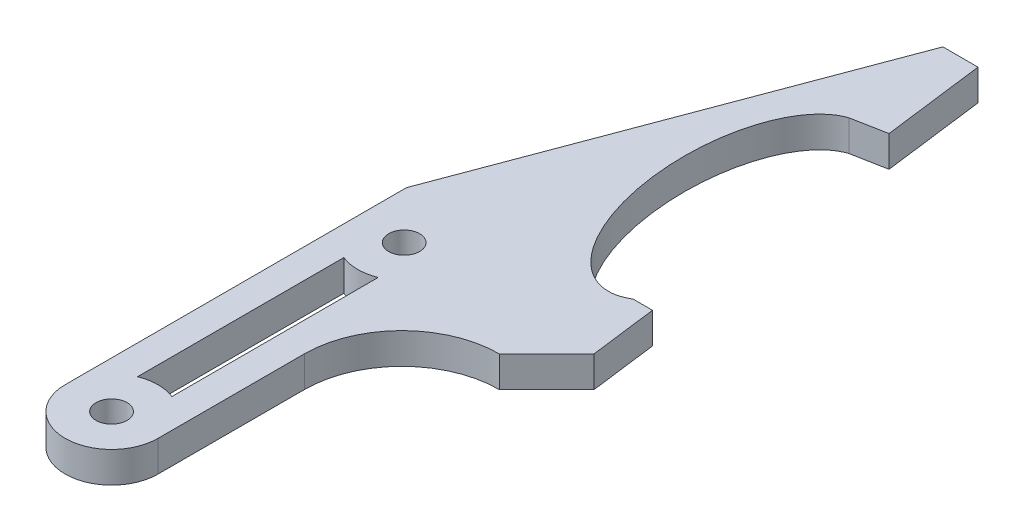
from build123d import *

# Parameters (mm, degrees)
CROQUIS1_R                   = 1.5875
SALIENTE_EXTRUIR1_DEPTH      = 3.175
CORTAR_EXTRUIR1_DEPTH        = 3.175
CORTAR_EXTRUIR3_DEPTH        = 10
CROQUIS4_R                   = 10
CORTAR_EXTRUIR4_DEPTH        = 10
REDONDEO1_R                  = 2
ENL_V_MAT_EXTRU_1_DEPTH      = 43.027736377
ENL_V_MAT_EXTRU_1_DEPTH_BACK = 4
ESQUISSE1_RX                 = 14
ESQUISSE1_RY                 = 7.031711939
ESQUISSE2_W                  = 9.071953096
ESQUISSE2_H                  = 3.948156649
ENL_V_MAT_EXTRU_2_DEPTH      = 43.02773651
CHANFREIN1_START             = -27.627623392
CHANFREIN1_OUTLINE_W         = 3.506874848
CHANFREIN1_OUTLINE_H         = 3.175
CHANFREIN1_DEPTH             = 1.390086692
CHANFREIN1_START_2           = -27.652783734
CHANFREIN1_2_OUTLINE_W       = 3.506874848
CHANFREIN1_2_OUTLINE_H       = 3.175
CHANFREIN1_2_DEPTH           = 0.025160342


with BuildPart() as part:
    # Croquis1 → Saliente-Extruir1 (new body)
    with BuildSketch(Plane(origin=(0, 0, 0), x_dir=(1, 0, 0), z_dir=(0, 1, 0))):
        with BuildLine():
            Line((-12.5, 0), (-12.5, -40))
            Line((-12.5, -40), (-2.975, -40))
            Line((-2.975, -40), (-2.975, -20))
            ThreePointArc((-2.975, -20), (-0.046067812, -12.928932188), (7.025, -10))
            Line((7.025, -10), (12.5, -10))
            Line((12.5, -10), (12.5, 40))
            Line((12.5, 40), (2.5, 40))
            Line((2.5, 40), (-12.5, 0))
        make_face()
        with Locations(Location((-7.7375, -5, 0), (0, 0, 270))):
            Circle(CROQUIS1_R, mode=Mode.SUBTRACT)
        with Locations(Location((-7.7375, -35, 0), (0, 0, 270))):
            Circle(CROQUIS1_R, mode=Mode.SUBTRACT)
    extrude(amount=SALIENTE_EXTRUIR1_DEPTH)

    # Croquis2 → Cortar-Extruir1 (cut)
    with BuildSketch(Plane(origin=(0, 3.175, 0), x_dir=(1, 0, 0), z_dir=(0, 1, 0))):
        Polygon((12.5, -10), (6.1, 40), (12.5, 40), align=None)
    extrude(amount=-CORTAR_EXTRUIR1_DEPTH, mode=Mode.SUBTRACT)

    # Croquis3 → Cortar-Extruir3 (cut)
    with BuildSketch(Plane(origin=(0, 3.175, 0), x_dir=(1, 0, 0), z_dir=(0, 1, 0))):
        with BuildLine():
            ThreePointArc((-5.975, -30.575635639), (-7.7375, -30.2375), (-9.5, -30.575635639))
            Line((-9.5, -30.575635639), (-9.5, -9.427055314))
            ThreePointArc((-9.5, -9.427055314), (-7.7375, -9.765), (-5.975, -9.427055314))
            Line((-5.975, -9.427055314), (-5.975, -14.803847577))
            Line((-5.975, -14.803847577), (-5.975, -30.575635639))
        make_face()
        with BuildLine():
            ThreePointArc((-12.5, -35), (-7.7375, -39.7625), (-2.975, -35))
            Line((-2.975, -35), (-2.975, -40))
            Line((-2.975, -40), (-12.5, -40))
            Line((-12.5, -40), (-12.5, -35))
        make_face()
    extrude(amount=-CORTAR_EXTRUIR3_DEPTH, mode=Mode.SUBTRACT)

    # Croquis4 → Cortar-Extruir4 (cut)
    with BuildSketch(Plane(origin=(0, 3.175, 0), x_dir=(1, 0, 0), z_dir=(0, 1, 0))):
        with Locations((9.274103387, 15.202317292)):
            Circle(CROQUIS4_R)
        Polygon((7.025, -10), (11.878723404, -5.146276596), (12.5, -10), align=None)
    extrude(amount=-CORTAR_EXTRUIR4_DEPTH, mode=Mode.SUBTRACT)

    # Redondeo1
    redondeo1_edges = [part.edges().sort_by_distance(p)[0] for p in [
        (8.004462032, 1.5875, -25.121390375),
        (10.543744741, 1.5875, -5.283244209),
    ]]
    fillet(redondeo1_edges, radius=REDONDEO1_R)

    # Esquisse1 → Enlèv. mat.-Extru.1 (cut, two sides: drawn at the far end of the back side and taken through both)
    with BuildSketch(Plane.XZ.offset(-ENL_V_MAT_EXTRU_1_DEPTH_BACK)):
        with Locations(Location((6.06176106, -15.09925225), (0, 0, -95.443545347))):
            Ellipse(ESQUISSE1_RX, ESQUISSE1_RY)
    extrude(amount=ENL_V_MAT_EXTRU_1_DEPTH + ENL_V_MAT_EXTRU_1_DEPTH_BACK, mode=Mode.SUBTRACT)

    # Esquisse2 → Enlèv. mat.-Extru.2 (cut, through all)
    with BuildSketch(Plane(origin=(0, 3.175, 0), x_dir=(1, 0, 0), z_dir=(0, 1, 0))):
        with Locations((11.233998337, 3.697201044)):
            Rectangle(ESQUISSE2_W, ESQUISSE2_H)
    extrude(amount=-ENL_V_MAT_EXTRU_2_DEPTH, mode=Mode.SUBTRACT)

    # Chanfrein1: read off the stored shape, not the designer's step
    # Chanfrein1 outline → Chanfrein1 (cut)
    with BuildSketch(Plane(origin=(0, 0, 0), x_dir=(0.9823357851879482, 0, -0.18712670878091503), z_dir=(0.18712670878091503, 0, 0.9823357851879482)).offset(CHANFREIN1_START)):
        with Locations((11.081851268, 1.5875)):
            Rectangle(CHANFREIN1_OUTLINE_W, CHANFREIN1_OUTLINE_H)
    extrude(amount=CHANFREIN1_DEPTH, mode=Mode.SUBTRACT)

    # Chanfrein1 2 outline → Chanfrein1 2 (add)
    with BuildSketch(Plane(origin=(0, 0, 0), x_dir=(0.9823357851879482, 0, -0.18712670878091503), z_dir=(0.18712670878091503, 0, 0.9823357851879482)).offset(CHANFREIN1_START_2)):
        with Locations((11.081851268, 1.5875)):
            Rectangle(CHANFREIN1_2_OUTLINE_W, CHANFREIN1_2_OUTLINE_H)
    extrude(amount=CHANFREIN1_2_DEPTH)


solid = part.part
